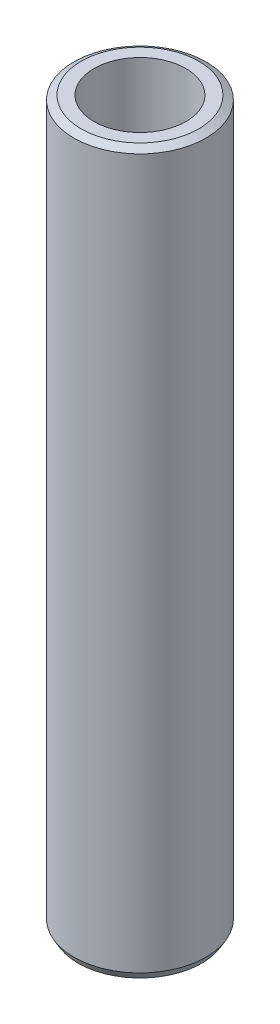
from build123d import *
from OCP.BRepFilletAPI import BRepFilletAPI_MakeChamfer

# Parameters (mm, degrees)
SKETCH1_R           = 55
BOSS_EXTRUDE1_DEPTH = 600
SKETCH2_R           = 38.265946333
CUT_EXTRUDE1_DEPTH  = 606.020660804
CHAMFER1_SIZE       = 3.545691112
CHAMFER1_SIZE2      = 6.141317155


with BuildPart() as part:
    # Sketch1 → Boss-Extrude1 (new body)
    with BuildSketch(Plane(origin=(0, 0, 0), x_dir=(1, 0, 0), z_dir=(0, 1, 0))):
        Circle(SKETCH1_R)
    extrude(amount=BOSS_EXTRUDE1_DEPTH)

    # Sketch2 → Cut-Extrude1 (cut, through all)
    with BuildSketch(Plane(origin=(0, 0, 0), x_dir=(1, 0, 0), z_dir=(0, 1, 0))):
        Circle(SKETCH2_R)
    extrude(amount=CUT_EXTRUDE1_DEPTH, mode=Mode.SUBTRACT)

    # Chamfer1: one chamfer whose edges measure the first distance from different faces: ONE call of the kernel's chamfer builder (chamfer() names one face for all edges)
    chamfer1_edges_1 = [part.edges().sort_by_distance(p)[0] for p in [
        (-55, 600, 0),
    ]]
    chamfer1_side_1 = [part.faces().sort_by_distance(p)[0] for p in [
        (-55, 300, 0),
    ]]
    chamfer1_edges_2 = [part.edges().sort_by_distance(p)[0] for p in [
        (-55, 0, 0),
    ]]
    chamfer1_side_2 = [part.faces().sort_by_distance(p)[0] for p in [
        (-53.444365081, 0, 0),
    ]]
    chamfer1 = BRepFilletAPI_MakeChamfer(part.part.solid().wrapped)
    for e in chamfer1_edges_1:
        chamfer1.Add(CHAMFER1_SIZE, CHAMFER1_SIZE2, e.wrapped, chamfer1_side_1[0].wrapped)  # the first distance lies on this face
    for e in chamfer1_edges_2:
        chamfer1.Add(CHAMFER1_SIZE, CHAMFER1_SIZE2, e.wrapped, chamfer1_side_2[0].wrapped)  # the first distance lies on this face
    add(Compound.cast(chamfer1.Shape()), mode=Mode.REPLACE)


solid = part.part
